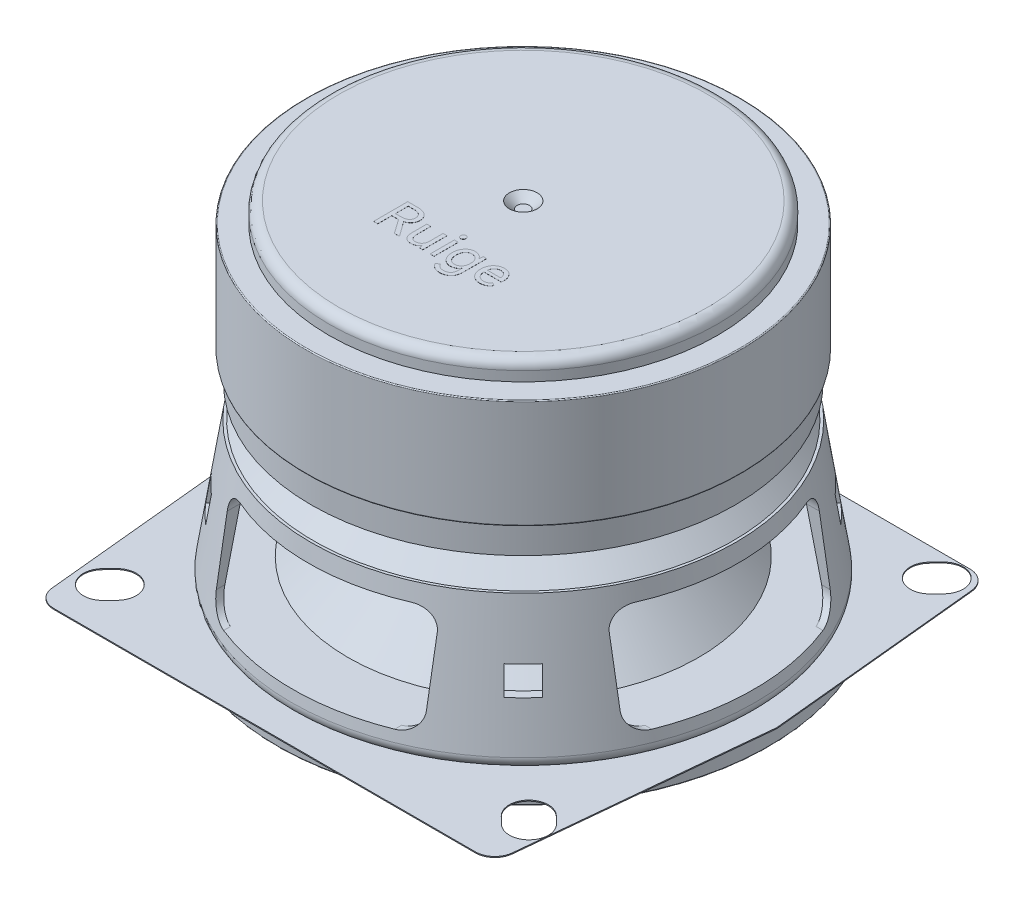
from build123d import *

# Parameters (mm, degrees)
SKETCH_2_R               = 19.925
EXTRUDE_1_DEPTH          = 2
SKETCH_3_R               = 22.3
EXTRUDE_2_DEPTH          = 11.15
SKETCH_4_R               = 21.75
EXTRUDE_3_DEPTH          = 3
SKETCH_5_R               = 18.225
EXTRUDE_4_DEPTH          = 3.3
EXTRUDE_4_DRAFT          = -45
EXTRUDE_5_DEPTH          = 0.1
SKETCH_12_R              = 25.25
EXTRUDE_7_DEPTH          = 2
FILLET_1_R               = 1
FILLET_2_R               = 0.1
FILLET_5_R               = 0.1
CUT_EXTRUDE_3_DEPTH      = 52.643943488
PATTERN_CIRCULAR_1_COUNT = 4
SKETCH_17_R              = 23
CUT_EXTRUDE_4_DEPTH      = 12.125994
CUT_EXTRUDE_4_TAPER      = 12
EXTRUDE_9_REACH          = 50.737
SKETCH_19_R              = 17.996686734
EXTRUDE_9_DRAFT          = 45
CUT_EXTRUDE_START        = -33.9
CUT_EXTRUDE_5_DEPTH      = 33.9
PATTERN_CIRCULAR_2_COUNT = 4
SKETCH_27_R              = 24.25
CUT_EXTRUDE_6_DEPTH      = 1
SKETCH_28_R              = 17.5
CUT_EXTRUDE_7_DEPTH      = 7
CUT_EXTRUDE_7_DRAFT      = -45
FILLET_6_R               = 0.1
SKETCH_30_W              = 0.406719368
SKETCH_30_H              = 2.481126482
EXTRUDE_11_DEPTH         = 0.01
CUT_EXTRUDE_START_2      = 30
SKETCH_31_W              = 2.706391377
SKETCH_31_H              = 2.784707462
CUT_EXTRUDE_8_DEPTH      = 10
PATTERN_CIRCULAR_3_COUNT = 4
FILLET_7_R               = 1
FILLET_8_R               = 1


# Read off the part's stored shape, not the designer's step: 曲面-缝合2
with BuildPart() as part:
    # 草图2 → 凸台-拉伸1 (new body)
    with BuildSketch(Plane(origin=(0, 0, 0), x_dir=(1, 0, 0), z_dir=(0, 1, 0))):
        with Locations(Location((0, 0, 0), (0, 0, 270))):
            Circle(SKETCH_2_R)
    extrude(amount=-EXTRUDE_1_DEPTH)

    # 草图14 → 切除-旋转1 (revolve, cut)
    with BuildSketch(Plane.XY, mode=Mode.PRIVATE) as cut_revolve_1_sk:
        Polygon((0, 0), (0, -0.717703915), (0.633716951, -0.717703915), (1.426933152, 0), align=None)
    revolve(cut_revolve_1_sk.sketch.rotate(Axis((0, 0, 0), (0, -1, 0)), 270), axis=Axis((0, 0, 0), (0, -1, 0)), mode=Mode.SUBTRACT)

    # 圆角1
    fillet_1_edges = [part.edges().sort_by_distance(p)[0] for p in [
        (0, 0, -19.925),
    ]]
    fillet(fillet_1_edges, radius=FILLET_1_R)

    # 草图30 → 凸台-拉伸11 (add)
    # profile 1 of 6: a face of its own
    with BuildSketch(Plane(origin=(0, 0, 0), x_dir=(1, 0, 0), z_dir=(0, 1, 0))):
        with BuildLine():
            Line((-3.189977143, -9.508206591), (-3.711518645, -9.508206591))
            Line((-3.711518645, -9.508206591), (-4.724858565, -8.073621611))
            Line((-4.724858565, -8.073621611), (-4.767743941, -8.073621611))
            Line((-4.767743941, -8.073621611), (-5.417941569, -8.073621611))
            Line((-5.417941569, -8.073621611), (-5.417941569, -9.508206591))
            Line((-5.417941569, -9.508206591), (-5.844028526, -9.508206591))
            Line((-5.844028526, -9.508206591), (-5.844028526, -6.008206591))
            Line((-5.844028526, -6.008206591), (-4.767743941, -6.008206591))
            add(Edge.make_bspline(
                [(-4.767743941, -6.008206591), (-4.70955201, -6.009767727), (-4.595872808, -6.01281744), (-4.430543422, -6.03754974), (-4.274878485, -6.077294392), (-4.153398813, -6.125045973), (-4.062266763, -6.170555461), (-3.997880606, -6.207743839), (-3.937430612, -6.248811533), (-3.880890416, -6.293018597), (-3.827668416, -6.340105273), (-3.779572492, -6.391437805), (-3.734934017, -6.445717016), (-3.694278018, -6.503045755), (-3.65745215, -6.562864703), (-3.626314425, -6.625824059), (-3.599491507, -6.690508681), (-3.576754117, -6.75735909), (-3.560894465, -6.826554583), (-3.547739113, -6.897537495), (-3.541247241, -6.970932874), (-3.539944619, -7.020614984), (-3.539285443, -7.045755998)],
                knots=[0, 0, 0, 0, 1.934696954, 3.779472598, 5.546483382, 7.268182974, 8.108419679, 8.933114725, 9.739238456, 10.536928548, 11.31898344, 12.100135439, 12.873874383, 13.654800496, 14.436027776, 15.20767373, 15.988110199, 16.764125966, 17.552770483, 18.347062047, 19.163551324, 20, 20, 20, 20], degree=3))
            add(Edge.make_bspline(
                [(-3.539285443, -7.045755998), (-3.539680007, -7.073918297), (-3.540461879, -7.129724973), (-3.550819415, -7.211739879), (-3.565567295, -7.290971813), (-3.587440046, -7.367012503), (-3.614774665, -7.440323822), (-3.649206268, -7.51034914), (-3.688473091, -7.578160438), (-3.735148815, -7.641868893), (-3.785880629, -7.702992655), (-3.842450506, -7.758840629), (-3.902609103, -7.811458631), (-3.96869255, -7.858060435), (-4.038689009, -7.901045982), (-4.113067369, -7.94024851), (-4.192631903, -7.973880145), (-4.247926345, -7.992792934), (-4.275945522, -8.002376551)],
                knots=[0, 0, 0, 0, 1.040008213, 2.060890069, 3.050100258, 4.015617353, 4.980908869, 5.937361294, 6.895936475, 7.87251746, 8.852141338, 9.828127481, 10.806787564, 11.802179348, 12.811907597, 13.84086371, 14.905907697, 16, 16, 16, 16], degree=3))
            Line((-4.275945522, -8.002376551), (-3.189977143, -9.508206591))
        make_face()
        with BuildLine():
            Line((-5.417941569, -6.381724377), (-5.417941569, -7.700795524))
            Line((-5.417941569, -7.700795524), (-4.820313111, -7.700795524))
            add(Edge.make_bspline(
                [(-4.820313111, -7.700795524), (-4.787552491, -7.700299923), (-4.723765511, -7.699334958), (-4.631119158, -7.690854923), (-4.544248608, -7.677578243), (-4.463942606, -7.657119145), (-4.389042171, -7.632663159), (-4.320746178, -7.601218611), (-4.257550365, -7.565533731), (-4.201770653, -7.522914976), (-4.151531445, -7.476507335), (-4.10788884, -7.425948376), (-4.07061385, -7.371585591), (-4.041248766, -7.3131601), (-4.017081975, -7.251737034), (-4.000739626, -7.186414121), (-3.990914775, -7.117300749), (-3.989576217, -7.069998921), (-3.988890186, -7.045755998)],
                knots=[0, 0, 0, 0, 1.314087679, 2.558611031, 3.729626903, 4.835706093, 5.880026302, 6.885990906, 7.847505876, 8.78550528, 9.695301978, 10.587288996, 11.459633258, 12.332565881, 13.205253402, 14.102691954, 15.027600109, 16, 16, 16, 16], degree=3))
            add(Edge.make_bspline(
                [(-3.988890186, -7.045755998), (-3.989604467, -7.021747994), (-3.991011456, -6.974457131), (-4.00060358, -6.905295153), (-4.017389385, -6.839433445), (-4.040870127, -6.777275992), (-4.070847496, -6.71845892), (-4.107802343, -6.663450827), (-4.151757149, -6.612283782), (-4.201459699, -6.564368704), (-4.257761776, -6.521318388), (-4.320459669, -6.483848959), (-4.38919931, -6.452218736), (-4.463643745, -6.425698608), (-4.544288157, -6.405706511), (-4.631148696, -6.39254529), (-4.723724391, -6.382946294), (-4.787545808, -6.382138907), (-4.820313111, -6.381724377)],
                knots=[0, 0, 0, 0, 0.958943898, 1.888923538, 2.782433681, 3.668508104, 4.53761959, 5.413778369, 6.308853537, 7.227314963, 8.166777724, 9.133430475, 10.138837689, 11.184606099, 12.285843585, 13.451733503, 14.691664551, 16, 16, 16, 16], degree=3))
            Line((-4.820313111, -6.381724377), (-5.417941569, -6.381724377))
        make_face(mode=Mode.SUBTRACT)
    # profile 2 of 6: a face of its own
    with BuildSketch(Plane(origin=(0, 0, 0), x_dir=(1, 0, 0), z_dir=(0, 1, 0))):
        with BuildLine():
            Line((-1.206874376, -7.022238211), (-0.800155008, -7.022238211))
            Line((-0.800155008, -7.022238211), (-0.800155008, -9.508206591))
            Line((-0.800155008, -9.508206591), (-1.159147103, -9.508206591))
            add(Edge.make_bspline(
                [(-1.159147103, -9.508206591), (-1.160535092, -9.469228953), (-1.163197642, -9.394458963), (-1.17057106, -9.287745479), (-1.177676871, -9.191058254), (-1.184345526, -9.130292898), (-1.187506787, -9.101487223)],
                knots=[0, 0, 0, 0, 1.147570014, 2.201359651, 3.14735877, 4, 4, 4, 4], degree=3))
            add(Edge.make_bspline(
                [(-1.187506787, -9.101487223), (-1.208964182, -9.138250914), (-1.250988349, -9.210252358), (-1.332739145, -9.303466301), (-1.423276567, -9.384371252), (-1.526195961, -9.448220683), (-1.635817704, -9.499071087), (-1.751739365, -9.533622234), (-1.871778156, -9.557443283), (-1.953790782, -9.559653887), (-1.995411925, -9.560775761)],
                knots=[0, 0, 0, 0, 1.043107617, 2.042919323, 3.029902987, 4.014805639, 5.005420554, 5.988678049, 6.979260601, 8, 8, 8, 8], degree=3))
            add(Edge.make_bspline(
                [(-1.995411925, -9.560775761), (-2.027737465, -9.560033729), (-2.091023814, -9.558580991), (-2.183131491, -9.545624321), (-2.270728891, -9.525978908), (-2.352885692, -9.496654345), (-2.4308401, -9.459824811), (-2.503286935, -9.414017934), (-2.57104211, -9.360260828), (-2.633291694, -9.298645811), (-2.689433109, -9.229456829), (-2.738115434, -9.152835665), (-2.778801239, -9.06912449), (-2.812951683, -8.979206856), (-2.838286227, -8.881943334), (-2.856555896, -8.778312537), (-2.868993811, -8.667629163), (-2.869929609, -8.591510004), (-2.870411925, -8.552277737)],
                knots=[0, 0, 0, 0, 1.02646394, 2.009592267, 2.949556311, 3.87394986, 4.774974462, 5.683442121, 6.59063901, 7.517814613, 8.460486302, 9.41557047, 10.395089971, 11.412760249, 12.466412819, 13.582845246, 14.754184101, 16, 16, 16, 16], degree=3))
            Line((-2.870411925, -8.552277737), (-2.870411925, -7.022238211))
            Line((-2.870411925, -7.022238211), (-2.464384257, -7.022238211))
            Line((-2.464384257, -7.022238211), (-2.464384257, -8.4422975))
            add(Edge.make_bspline(
                [(-2.464384257, -8.4422975), (-2.464070583, -8.470903408), (-2.463459949, -8.526590858), (-2.456312046, -8.607426612), (-2.445332918, -8.683197933), (-2.430429623, -8.754090942), (-2.410211562, -8.819935468), (-2.386226238, -8.880924456), (-2.357759726, -8.936931602), (-2.324526608, -8.9874541), (-2.287222317, -9.032751389), (-2.245423919, -9.071905073), (-2.199185219, -9.104603387), (-2.149331429, -9.131732578), (-2.095120708, -9.152653232), (-2.037129647, -9.16771401), (-1.97472836, -9.176989226), (-1.931809012, -9.177831068), (-1.909641174, -9.178265879)],
                knots=[0, 0, 0, 0, 1.312331565, 2.5547309, 3.72033348, 4.82433299, 5.87524264, 6.877240598, 7.828343218, 8.75270601, 9.646781812, 10.515133921, 11.372393191, 12.238744858, 13.113070833, 14.031785177, 14.983417282, 16, 16, 16, 16], degree=3))
            add(Edge.make_bspline(
                [(-1.909641174, -9.178265879), (-1.879605904, -9.177116785), (-1.820302051, -9.174847929), (-1.732610121, -9.159276715), (-1.648065454, -9.132894533), (-1.566796501, -9.095920359), (-1.489982354, -9.049598298), (-1.420503397, -8.991025527), (-1.359087426, -8.922035777), (-1.304382979, -8.8437073), (-1.260788829, -8.754414729), (-1.228915172, -8.655528901), (-1.210137514, -8.546991764), (-1.207988207, -8.471655205), (-1.206874376, -8.432613705)],
                knots=[0, 0, 0, 0, 0.940580303, 1.857151149, 2.779931299, 3.707502802, 4.647556224, 5.580509548, 6.541874121, 7.533440932, 8.563698858, 9.641625836, 10.777824937, 12, 12, 12, 12], degree=3))
            Line((-1.206874376, -8.432613705), (-1.206874376, -7.022238211))
        make_face()
    # profile 3 of 6: a face of its own
    with BuildSketch(Plane(origin=(0, 0, 0), x_dir=(1, 0, 0), z_dir=(0, 1, 0))):
        with BuildLine():
            add(Edge.make_bspline(
                [(0.157157245, -6.582317263), (0.139300345, -6.581185004), (0.10429795, -6.578965596), (0.053709163, -6.563361081), (0.007893929, -6.535999917), (-0.032799, -6.49960513), (-0.067420285, -6.456848843), (-0.091568274, -6.408806718), (-0.108134342, -6.358133467), (-0.109724725, -6.322831612), (-0.110530502, -6.304945721)],
                knots=[0, 0, 0, 0, 1.004394132, 1.968774074, 2.945640664, 3.984309649, 5.027829232, 6.020083187, 6.996863615, 8, 8, 8, 8], degree=3))
            add(Edge.make_bspline(
                [(-0.110530502, -6.304945721), (-0.109687482, -6.287072613), (-0.108013158, -6.251574784), (-0.091900451, -6.200712944), (-0.067176303, -6.152937112), (-0.032830322, -6.110271323), (0.007901752, -6.07389527), (0.053707163, -6.046529405), (0.104298472, -6.030926096), (0.139300522, -6.028706522), (0.157157245, -6.02757418)],
                knots=[0, 0, 0, 0, 1.003023882, 1.992108573, 2.972734647, 4.016137197, 5.054689694, 6.031446727, 6.995718512, 8, 8, 8, 8], degree=3))
            add(Edge.make_bspline(
                [(0.157157245, -6.02757418), (0.175721416, -6.028377995), (0.211910603, -6.02994496), (0.263775518, -6.046029866), (0.311028347, -6.071961723), (0.351981587, -6.108207898), (0.386298808, -6.150463519), (0.412234129, -6.197820333), (0.427023224, -6.250118395), (0.428786353, -6.28640961), (0.429686889, -6.304945721)],
                knots=[0, 0, 0, 0, 1.027222024, 2.00247727, 2.981500095, 3.997108382, 5.015933681, 5.988837292, 6.972777976, 8, 8, 8, 8], degree=3))
            add(Edge.make_bspline(
                [(0.429686889, -6.304945721), (0.428854783, -6.322819099), (0.427212432, -6.358096258), (0.410964175, -6.409159678), (0.385017816, -6.456910668), (0.349185208, -6.49944668), (0.307801755, -6.536058165), (0.261260931, -6.563369506), (0.210226532, -6.578893648), (0.175010621, -6.581165503), (0.157157245, -6.582317263)],
                knots=[0, 0, 0, 0, 0.995440633, 1.964727503, 2.961416234, 4.013131, 5.053515803, 6.034024399, 7.003311269, 8, 8, 8, 8], degree=3))
        make_face()
    # profile 4 of 6: a face of its own
    with BuildSketch(Plane(origin=(0, 0, 0), x_dir=(1, 0, 0), z_dir=(0, 1, 0))):
        with Locations((0.155082146, -8.26764335)):
            Rectangle(SKETCH_30_W, SKETCH_30_H)
    # profile 5 of 6: a face of its own
    with BuildSketch(Plane(origin=(0, 0, 0), x_dir=(1, 0, 0), z_dir=(0, 1, 0))):
        with BuildLine():
            Line((3.268422067, -7.022238211), (3.268422067, -9.350499081))
            add(Edge.make_bspline(
                [(3.268422067, -9.350499081), (3.267354786, -9.408404324), (3.265292453, -9.520296081), (3.249718177, -9.681582794), (3.222618964, -9.829810498), (3.186396804, -9.965477324), (3.136425587, -10.087257257), (3.078310336, -10.197068857), (3.007541436, -10.293194542), (2.926115541, -10.375282209), (2.837692151, -10.445624394), (2.74524951, -10.506819843), (2.648901362, -10.559140297), (2.548146192, -10.60111376), (2.443705269, -10.634926633), (2.334998134, -10.658092657), (2.222255839, -10.672261397), (2.145835459, -10.674147024), (2.107058431, -10.675103824)],
                knots=[0, 0, 0, 0, 1.387567974, 2.681232473, 3.877697983, 4.995691513, 6.039179059, 7.025636496, 7.966083473, 8.888172103, 9.788194353, 10.669362649, 11.542053707, 12.411239405, 13.281443111, 14.169032291, 15.070935183, 16, 16, 16, 16], degree=3))
            add(Edge.make_bspline(
                [(2.107058431, -10.675103824), (2.076844929, -10.674451271), (2.017033677, -10.673159465), (1.92849899, -10.66654148), (1.842613709, -10.653883207), (1.759412484, -10.636716461), (1.678848688, -10.614339875), (1.600475342, -10.58775687), (1.52513174, -10.554597649), (1.451878862, -10.518590796), (1.383022055, -10.477394388), (1.319642437, -10.431504539), (1.262241573, -10.381520722), (1.209607234, -10.328084707), (1.163551145, -10.269778437), (1.122498495, -10.20819757), (1.087248511, -10.142483933), (1.069048223, -10.096125565), (1.059825229, -10.072633468)],
                knots=[0, 0, 0, 0, 1.126863424, 2.230761376, 3.308088145, 4.362001396, 5.396623865, 6.424435996, 7.445030255, 8.463993448, 9.466684361, 10.433223884, 11.377948486, 12.302143894, 13.22597928, 14.144075382, 15.059510446, 16, 16, 16, 16], degree=3))
            Line((1.059825229, -10.072633468), (1.38976594, -9.885874575))
            add(Edge.make_bspline(
                [(1.38976594, -9.885874575), (1.405969118, -9.918359806), (1.437689687, -9.981955356), (1.50300288, -10.064512096), (1.577002666, -10.136152314), (1.663115346, -10.193733214), (1.760263344, -10.238532956), (1.868020128, -10.269614011), (1.986421448, -10.289675956), (2.068926814, -10.291594602), (2.111900328, -10.292593943)],
                knots=[0, 0, 0, 0, 0.986581066, 1.931405895, 2.851090693, 3.78315513, 4.738672708, 5.754261975, 6.830291184, 8, 8, 8, 8], degree=3))
            add(Edge.make_bspline(
                [(2.111900328, -10.292593943), (2.14028405, -10.291893661), (2.19560816, -10.290528709), (2.276265156, -10.280971604), (2.352092416, -10.264060113), (2.423611086, -10.241858604), (2.489930756, -10.211173203), (2.552549319, -10.175892025), (2.609416925, -10.132024208), (2.662866869, -10.082972693), (2.710676116, -10.024668854), (2.751452634, -9.956001759), (2.785774482, -9.877353758), (2.813961509, -9.789001497), (2.835787148, -9.691062451), (2.851691493, -9.583358053), (2.860206064, -9.465458412), (2.861645294, -9.383482798), (2.862394399, -9.340815286)],
                knots=[0, 0, 0, 0, 0.979769389, 1.909716748, 2.79803167, 3.658858974, 4.488814631, 5.316094608, 6.134289243, 6.962066787, 7.816060114, 8.726491223, 9.709971201, 10.772136686, 11.922898153, 13.170055792, 14.527041492, 16, 16, 16, 16], degree=3))
            Line((2.862394399, -9.340815286), (2.862394399, -9.125696709))
            add(Edge.make_bspline(
                [(2.862394399, -9.125696709), (2.838701987, -9.160819244), (2.792260033, -9.229666566), (2.706815624, -9.31847899), (2.614060527, -9.395035942), (2.511632294, -9.455592985), (2.403518997, -9.502840976), (2.29052607, -9.535953283), (2.173764664, -9.556740228), (2.09446335, -9.559423288), (2.054489261, -9.560775761)],
                knots=[0, 0, 0, 0, 1.058392397, 2.074664658, 3.071289606, 4.059798142, 5.041666933, 6.016526416, 7.000173572, 8, 8, 8, 8], degree=3))
            add(Edge.make_bspline(
                [(2.054489261, -9.560775761), (2.007991961, -9.558932203), (1.915236781, -9.555254579), (1.778508464, -9.524871342), (1.645814737, -9.476153575), (1.540443915, -9.419284884), (1.458954229, -9.365942645), (1.400931849, -9.319785336), (1.345368743, -9.270221421), (1.293532075, -9.215570319), (1.243285965, -9.157793763), (1.197268757, -9.094432399), (1.15355246, -9.027428903), (1.113290346, -8.956167002), (1.077793163, -8.880844805), (1.045309469, -8.802687079), (1.019726951, -8.720727584), (0.996874763, -8.636242059), (0.980958421, -8.547998477), (0.967986706, -8.456690292), (0.961481838, -8.36192293), (0.960185534, -8.29773963), (0.959528786, -8.265222401)],
                knots=[0, 0, 0, 0, 1.474149278, 2.940708008, 4.422156041, 5.947400143, 6.728641115, 7.510224601, 8.297676016, 9.089364625, 9.898805631, 10.725585592, 11.571818849, 12.436665928, 13.320249657, 14.212874383, 15.119865783, 16.042654519, 16.98827688, 17.962972923, 18.967979574, 20, 20, 20, 20], degree=3))
            add(Edge.make_bspline(
                [(0.959528786, -8.265222401), (0.959788422, -8.232694203), (0.960301081, -8.168466054), (0.96852761, -8.073858045), (0.979970475, -7.982146139), (0.99640232, -7.893854912), (1.018163214, -7.808687249), (1.044196461, -7.726577382), (1.075354604, -7.647518215), (1.111418543, -7.572067761), (1.151553054, -7.500466433), (1.194250697, -7.432636308), (1.239918094, -7.369299402), (1.289324524, -7.310937316), (1.342006598, -7.257093507), (1.397268065, -7.206888373), (1.456184872, -7.161986135), (1.538062915, -7.108897913), (1.644366228, -7.053083492), (1.777850894, -7.004776348), (1.915102377, -6.975426953), (2.008006534, -6.971589189), (2.054489261, -6.969669041)],
                knots=[0, 0, 0, 0, 1.029919977, 2.033615691, 3.005539346, 3.956579852, 4.875826833, 5.788085456, 6.683111172, 7.565051714, 8.434661075, 9.281527551, 10.102461249, 10.905663526, 11.700958861, 12.486945865, 13.268373622, 14.044150574, 15.576074162, 17.059124696, 18.528592174, 20, 20, 20, 20], degree=3))
            add(Edge.make_bspline(
                [(2.054489261, -6.969669041), (2.095394751, -6.971185419), (2.176881234, -6.974206144), (2.297154897, -6.996901012), (2.413977495, -7.034742581), (2.526101689, -7.087324483), (2.632733656, -7.153002423), (2.727772139, -7.235671007), (2.812373353, -7.332173048), (2.857860108, -7.40541762), (2.881070288, -7.442791571)],
                knots=[0, 0, 0, 0, 0.982847623, 1.957898417, 2.930615343, 3.927349737, 4.928389034, 5.930471017, 6.943997204, 8, 8, 8, 8], degree=3))
            add(Edge.make_bspline(
                [(2.881070288, -7.442791571), (2.888298071, -7.37021584), (2.902230076, -7.230321567), (2.907557879, -7.089839571), (2.910121672, -7.022238211)],
                knots=[0, 0, 0, 0, 1.037579736, 2, 2, 2, 2], degree=3))
            Line((2.910121672, -7.022238211), (3.268422067, -7.022238211))
        make_face()
        with BuildLine():
            add(Edge.make_bspline(
                [(2.102216533, -9.178265879), (2.127613684, -9.177608588), (2.177931174, -9.176306346), (2.251863169, -9.165732772), (2.323231183, -9.148349434), (2.391655617, -9.123902014), (2.45810483, -9.093654732), (2.520869128, -9.055036916), (2.581726488, -9.010677981), (2.638825996, -8.958852419), (2.692158656, -8.900118232), (2.737688959, -8.832344156), (2.776685895, -8.756941254), (2.808351445, -8.673850016), (2.832324084, -8.582638045), (2.850321139, -8.483940555), (2.860512132, -8.377030849), (2.861753588, -8.303287184), (2.862394399, -8.265222401)],
                knots=[0, 0, 0, 0, 0.90797867, 1.798910791, 2.664880779, 3.530732983, 4.394029247, 5.270806478, 6.161395104, 7.083823891, 8.02403018, 8.991467598, 9.994617027, 11.054327459, 12.164457308, 13.362943767, 14.638812269, 16, 16, 16, 16], degree=3))
            add(Edge.make_bspline(
                [(2.862394399, -8.265222401), (2.861756794, -8.227388732), (2.860525643, -8.154335746), (2.850366409, -8.048559253), (2.832112925, -7.9508513), (2.80852997, -7.860214158), (2.776472625, -7.777516362), (2.737925673, -7.702324257), (2.691917104, -7.635103847), (2.638857887, -7.576408889), (2.581709646, -7.524634864), (2.520904432, -7.480173016), (2.457898955, -7.441856773), (2.391992395, -7.410325137), (2.323053729, -7.387197449), (2.251891713, -7.369477299), (2.177923793, -7.35900017), (2.127611208, -7.357684758), (2.102216533, -7.35702082)],
                knots=[0, 0, 0, 0, 1.357577949, 2.621345624, 3.807657967, 4.921588707, 5.977205676, 6.983789713, 7.947709969, 8.89113536, 9.816722382, 10.710360227, 11.59013939, 12.459901171, 13.325995135, 14.194930053, 15.08891257, 16, 16, 16, 16], degree=3))
            add(Edge.make_bspline(
                [(2.102216533, -7.35702082), (2.075647918, -7.357508775), (2.023844527, -7.358460187), (1.948363168, -7.371043589), (1.876925269, -7.389466235), (1.808915018, -7.4151466), (1.745179905, -7.449029369), (1.686066622, -7.491323172), (1.630313499, -7.539842963), (1.579085285, -7.595881725), (1.533804448, -7.65912928), (1.493008527, -7.727696452), (1.460362869, -7.803087407), (1.432326257, -7.883658778), (1.411021532, -7.970524085), (1.396280249, -8.063544862), (1.386017169, -8.162392453), (1.385294442, -8.230379129), (1.384924043, -8.265222401)],
                knots=[0, 0, 0, 0, 0.976330282, 1.903645273, 2.806789368, 3.687347253, 4.571451925, 5.453927661, 6.355557015, 7.286124665, 8.239602965, 9.212796583, 10.215230919, 11.255974219, 12.348318781, 13.500098107, 14.718796573, 16, 16, 16, 16], degree=3))
            add(Edge.make_bspline(
                [(1.384924043, -8.265222401), (1.385286799, -8.300527263), (1.385992463, -8.369205497), (1.396292246, -8.46896831), (1.410989592, -8.562694229), (1.432499598, -8.650402807), (1.460028776, -8.7318617), (1.493239546, -8.80769351), (1.533580678, -8.876745248), (1.579104026, -8.940094505), (1.630341115, -8.996089744), (1.685844114, -9.044744824), (1.745412738, -9.086154109), (1.808884082, -9.120184337), (1.87693377, -9.145808308), (1.948360812, -9.164246479), (2.023845159, -9.176825609), (2.075648132, -9.177777618), (2.102216533, -9.178265879)],
                knots=[0, 0, 0, 0, 1.293269429, 2.515785494, 3.671563696, 4.767995356, 5.820807847, 6.819464788, 7.796291316, 8.746176699, 9.673237764, 10.571469579, 11.445774316, 12.326547487, 13.203787235, 14.103528084, 15.027348746, 16, 16, 16, 16], degree=3))
        make_face(mode=Mode.SUBTRACT)
    # profile 6 of 6: a face of its own
    with BuildSketch(Plane(origin=(0, 0, 0), x_dir=(1, 0, 0), z_dir=(0, 1, 0))):
        with BuildLine():
            add(Edge.make_bspline(
                [(5.057157245, -6.969669041), (5.083463952, -6.969927049), (5.135272099, -6.970435166), (5.211691089, -6.978668929), (5.28580186, -6.990384515), (5.357728466, -7.005711775), (5.426715988, -7.027624427), (5.493119301, -7.054078862), (5.557665917, -7.084243485), (5.639119692, -7.131254748), (5.733866601, -7.199417606), (5.83530243, -7.295075279), (5.920702659, -7.406192823), (5.992667028, -7.528573633), (6.049293985, -7.661363331), (6.089241125, -7.802230456), (6.114269135, -7.95007108), (6.117347344, -8.051155702), (6.118916138, -8.102672994)],
                knots=[0, 0, 0, 0, 0.724992502, 1.427792431, 2.116564281, 2.793707582, 3.453222815, 4.109605232, 4.763674536, 5.415794485, 6.700237486, 7.972810147, 9.245763864, 10.550886631, 11.878164362, 13.214243565, 14.580252596, 16, 16, 16, 16], degree=3))
            add(Edge.make_bspline(
                [(6.118916138, -8.102672994), (6.118253449, -8.145174641), (6.116981428, -8.226755865), (6.105194704, -8.307481519), (6.099548549, -8.346151255)],
                knots=[0, 0, 0, 0, 1.041946779, 2, 2, 2, 2], degree=3))
            Line((6.099548549, -8.346151255), (4.311505071, -8.346151255))
            add(Edge.make_bspline(
                [(4.311505071, -8.346151255), (4.313989157, -8.380561118), (4.318810579, -8.447348039), (4.334323074, -8.543966798), (4.355229532, -8.633887129), (4.383330184, -8.716799287), (4.416156732, -8.793333309), (4.455768467, -8.862977435), (4.501596554, -8.925768556), (4.553703039, -8.981187485), (4.610748394, -9.029509618), (4.671257437, -9.072149662), (4.735629323, -9.108261789), (4.80376303, -9.137064113), (4.874894235, -9.160485422), (4.950098141, -9.175972106), (5.028763674, -9.185887524), (5.08248904, -9.187255928), (5.109726415, -9.187949674)],
                knots=[0, 0, 0, 0, 1.270402116, 2.465753641, 3.600924155, 4.667274959, 5.686687033, 6.664373866, 7.612350246, 8.543781398, 9.459550565, 10.362067141, 11.267098308, 12.172727158, 13.083321442, 14.021236489, 14.996817948, 16, 16, 16, 16], degree=3))
            add(Edge.make_bspline(
                [(5.109726415, -9.187949674), (5.143212504, -9.186823291), (5.208238596, -9.184635985), (5.302497678, -9.169547218), (5.389513545, -9.143233661), (5.469351277, -9.106465355), (5.541500243, -9.058461801), (5.607181589, -9.000771296), (5.665012837, -8.931764766), (5.69627875, -8.879682867), (5.712196771, -8.853167065)],
                knots=[0, 0, 0, 0, 1.106054763, 2.147829746, 3.142897553, 4.100413216, 5.040442446, 5.995531711, 6.979490264, 8, 8, 8, 8], degree=3))
            Line((5.712196771, -8.853167065), (6.022769893, -9.030242164))
            add(Edge.make_bspline(
                [(6.022769893, -9.030242164), (6.014427837, -9.050955495), (5.997830133, -9.09216761), (5.965681754, -9.150151255), (5.928593044, -9.204747923), (5.886594211, -9.255843112), (5.83909551, -9.303039147), (5.786939906, -9.346959276), (5.729226312, -9.387116131), (5.645697824, -9.435481569), (5.533484165, -9.485646452), (5.391192768, -9.529478101), (5.240942161, -9.55549061), (5.138417876, -9.558992477), (5.086208628, -9.560775761)],
                knots=[0, 0, 0, 0, 0.702046881, 1.396821982, 2.080948413, 2.77666974, 3.474317387, 4.184895915, 4.919473551, 5.683446526, 7.21925995, 8.775092359, 10.35775491, 12, 12, 12, 12], degree=3))
            add(Edge.make_bspline(
                [(5.086208628, -9.560775761), (5.05851871, -9.560516632), (5.003720534, -9.560003819), (4.922717121, -9.551693834), (4.843646459, -9.540332824), (4.766492126, -9.523545349), (4.690957556, -9.502043694), (4.617124018, -9.47601065), (4.545382591, -9.44449558), (4.475907739, -9.408612619), (4.408577753, -9.36898149), (4.345621561, -9.32326653), (4.28507459, -9.274622544), (4.229144399, -9.220198862), (4.17649106, -9.161969276), (4.126932467, -9.099719346), (4.082421061, -9.03202984), (4.039816268, -8.961249946), (4.002505194, -8.885544688), (3.970333077, -8.806136347), (3.942072178, -8.723402804), (3.920620821, -8.63668768), (3.902091884, -8.54658402), (3.889936569, -8.452724753), (3.883136146, -8.355245033), (3.881898865, -8.289211987), (3.881267917, -8.255538607)],
                knots=[0, 0, 0, 0, 0.996902907, 1.972864621, 2.930095546, 3.873244509, 4.814380267, 5.75738296, 6.690865885, 7.63430732, 8.572911313, 9.501653459, 10.434249323, 11.368138535, 12.308907792, 13.26093673, 14.230659485, 15.224825783, 16.235061639, 17.266813331, 18.309437592, 19.381030963, 20.482052878, 21.621372957, 22.787025337, 24, 24, 24, 24], degree=3))
            add(Edge.make_bspline(
                [(3.881267917, -8.255538607), (3.881904192, -8.223018148), (3.883155588, -8.159058405), (3.889920355, -8.064566268), (3.902166116, -7.973254423), (3.920585493, -7.885434643), (3.942217863, -7.800612158), (3.970155835, -7.719611044), (4.002782842, -7.641763231), (4.039980808, -7.567352734), (4.081454903, -7.496543649), (4.127309844, -7.430390643), (4.175725942, -7.367776767), (4.227486368, -7.309503887), (4.28318007, -7.256357268), (4.341475908, -7.206644768), (4.403575736, -7.16195157), (4.46890884, -7.121775362), (4.536375523, -7.085970837), (4.605850865, -7.054586048), (4.677090316, -7.028391937), (4.749871581, -7.006910668), (4.824260362, -6.990104319), (4.900348515, -6.978802661), (4.978118713, -6.970431529), (5.030618807, -6.969925059), (5.057157245, -6.969669041)],
                knots=[0, 0, 0, 0, 1.198513757, 2.357181702, 3.489123074, 4.590582444, 5.662242429, 6.712845736, 7.74486878, 8.770823008, 9.776307263, 10.766161278, 11.734931765, 12.691742357, 13.63517989, 14.569698735, 15.512983212, 16.451472109, 17.39410582, 18.325839438, 19.258657189, 20.188878661, 21.12061228, 22.066342681, 23.022549465, 24, 24, 24, 24], degree=3))
        make_face()
        with BuildLine():
            add(Edge.make_bspline(
                [(5.042631553, -7.342495128), (5.020697386, -7.342995042), (4.977360741, -7.34398275), (4.913558347, -7.35279107), (4.851654779, -7.365626101), (4.79192516, -7.38449157), (4.734374185, -7.408584553), (4.679247832, -7.438879645), (4.626243107, -7.474008202), (4.575410466, -7.514103511), (4.528491943, -7.55986205), (4.485398821, -7.610401572), (4.447210297, -7.666066074), (4.414032199, -7.726710853), (4.384992713, -7.79198137), (4.359916127, -7.862175729), (4.339929161, -7.937403282), (4.330720892, -7.989616382), (4.326030763, -8.016210543)],
                knots=[0, 0, 0, 0, 0.974181983, 1.924749541, 2.857143545, 3.780657673, 4.703546441, 5.625069315, 6.571320365, 7.5265696, 8.497459598, 9.478727416, 10.473382572, 11.491402847, 12.546238478, 13.644799345, 14.800404723, 16, 16, 16, 16], degree=3))
            Line((4.326030763, -8.016210543), (5.678995189, -8.016210543))
            add(Edge.make_bspline(
                [(5.678995189, -8.016210543), (5.677304909, -7.990118808), (5.674016156, -7.939352524), (5.662827549, -7.865818145), (5.646992041, -7.796856237), (5.626160992, -7.732302698), (5.600920238, -7.671727319), (5.569412427, -7.616467762), (5.534008085, -7.565104067), (5.493095269, -7.5189771), (5.448266238, -7.477632923), (5.400239404, -7.441204507), (5.348714326, -7.410627354), (5.293743023, -7.38560689), (5.235502417, -7.366317298), (5.174123662, -7.35246176), (5.109502498, -7.34399358), (5.06525327, -7.343002038), (5.042631553, -7.342495128)],
                knots=[0, 0, 0, 0, 1.206755296, 2.347965007, 3.429941462, 4.470212713, 5.476652564, 6.453783143, 7.401774207, 8.352153161, 9.293847203, 10.213624225, 11.130130315, 12.054332322, 12.996928514, 13.95762573, 14.95586853, 16, 16, 16, 16], degree=3))
        make_face(mode=Mode.SUBTRACT)
    extrude(amount=EXTRUDE_11_DEPTH)


with BuildPart() as body_2:
    # 草图3 → 凸台-拉伸2 (new body)
    with BuildSketch(Plane.XZ.offset(2)):
        with Locations(Location((0, 0, 0), (0, 0, 270))):
            Circle(SKETCH_3_R)
    extrude(amount=EXTRUDE_2_DEPTH)

    # 草图4 → 凸台-拉伸3 (add)
    with BuildSketch(Plane.XZ.offset(13.15)):
        with Locations(Location((0, 0, 0), (0, 0, 270))):
            Circle(SKETCH_4_R)
    extrude(amount=EXTRUDE_3_DEPTH)


with BuildPart() as extrude_4_tool:
    # 草图5 → 凸台-拉伸4 (with draft: the straight prism first)
    with BuildSketch(Plane(origin=(0, -16.15, 0), x_dir=(-1, 0, 0), z_dir=(0, -1, 0))):
        Circle(SKETCH_5_R)
    extrude(amount=EXTRUDE_4_DEPTH)
    # 凸台-拉伸4: the draft: its side faces are tilted about the plane it starts from
    extrude_4_sides = [extrude_4_tool.faces().sort_by_distance(p)[0] for p in [
        (18.225, -17.8, 0),
    ]]
    draft(extrude_4_sides, Plane(origin=(0, -16.15, 0), x_dir=(-1, 0, 0), z_dir=(0, -1, 0)), EXTRUDE_4_DRAFT)


with BuildPart() as body_2_1:
    add(body_2.part)

    # 凸台-拉伸4: add extrude_4_tool
    add(extrude_4_tool.part)

    # 圆角2
    fillet_2_edges = [body_2_1.edges().sort_by_distance(p)[0] for p in [
        (0, -2, 22.3),
    ]]
    fillet(fillet_2_edges, radius=FILLET_2_R)

    # 圆角5
    fillet_5_edges = [body_2_1.edges().sort_by_distance(p)[0] for p in [
        (0, -13.15, 22.3),
    ]]
    fillet(fillet_5_edges, radius=FILLET_5_R)




with BuildPart() as body_3:
    # 草图11 → 凸台-拉伸5 (new body)
    with BuildSketch(Plane(origin=(0, -33.8, 0), x_dir=(-1, 0, 0), z_dir=(0, -1, 0))):
        with BuildLine():
            Line((21.830541038, 24), (-21.830541038, 24))
            ThreePointArc((-21.830541038, 24), (-23.173546947, 23.482003755), (-23.820880838, 22.196335129))
            Line((-23.820880838, 22.196335129), (-25.991049385, 0.196335129))
            ThreePointArc((-25.991049385, 0.196335129), (-26.000709585, 0), (-25.991049385, -0.196335129))
            Line((-25.991049385, -0.196335129), (-23.574270775, -24.696335129))
            ThreePointArc((-23.574270775, -24.696335129), (-22.926936885, -25.982003755), (-21.583930976, -26.5))
            Line((-21.583930976, -26.5), (21.693023621, -26.5))
            ThreePointArc((21.693023621, -26.5), (22.955360852, -26.013094435), (23.563757982, -24.804613882))
            Line((23.563757982, -24.804613882), (25.989642753, -0.196207972))
            ThreePointArc((25.989642753, -0.196207972), (25.999290415, 0), (25.989642753, 0.196207972))
            Line((25.989642753, 0.196207972), (23.820893377, 22.196207972))
            ThreePointArc((23.820893377, 22.196207972), (23.173594286, 23.481960854), (21.830541038, 24))
        make_face()
    extrude(amount=EXTRUDE_5_DEPTH)

    # 草图12 → 凸台-拉伸7 (add)
    with BuildSketch(Plane.XZ.offset(33.9)):
        with Locations(Location((0, 0, 0), (0, 0, 251.896186136))):
            Circle(SKETCH_12_R)
    extrude(amount=EXTRUDE_7_DEPTH)

    # 草图20 → 切除-拉伸5 (cut)
    with BuildSketch(Plane.XZ.offset(35.9).offset(CUT_EXTRUDE_START)):
        with BuildLine():
            Line((19.746834936, 22.007101354), (20.463501603, 22.704517219))
            ThreePointArc((20.463501603, 22.704517219), (23.291666667, 22.666015616), (23.253165064, 19.837850552))
            Line((23.253165064, 19.837850552), (22.536498397, 19.140434687))
            ThreePointArc((22.536498397, 19.140434687), (19.708333333, 19.17893629), (19.746834936, 22.007101354))
        make_face()
    cut_extrude_5 = extrude(amount=CUT_EXTRUDE_5_DEPTH, mode=Mode.SUBTRACT)

    # 阵列(圆周)2: 切除-拉伸5 ×4 about axis
    pattern_circular_2_axis = Axis((0, 0, 0), (0, 1, 0))
    for i in range(1, PATTERN_CIRCULAR_2_COUNT):
        add(cut_extrude_5.rotate(pattern_circular_2_axis, i * 360 / PATTERN_CIRCULAR_2_COUNT), mode=Mode.SUBTRACT)

    # 草图27 → 切除-拉伸6 (cut)
    with BuildSketch(Plane.XZ.offset(35.9)):
        with Locations(Location((0, 0, 0), (0, 0, 270))):
            Circle(SKETCH_27_R)
    extrude(amount=-CUT_EXTRUDE_6_DEPTH, mode=Mode.SUBTRACT)


with BuildPart() as body_4:
    # Knit 2 outline → Knit 2 (revolve)
    with BuildSketch(Plane.XY):
        Polygon((21.8, -19.45), (0, -19.45), (0, -33.8), (24, -33.8), align=None)
    revolve(axis=Axis((0, 0, 0), (0, 1, 0)))

    # 草图15 → 切除-拉伸3 (cut, symmetric)
    with BuildSketch(Plane.XY):
        with BuildLine():
            Line((-8.776386593, -21.162420253), (8.776386593, -21.162420253))
            ThreePointArc((8.776386593, -21.162420253), (10.190600155, -21.748206691), (10.776386593, -23.162420253))
            Line((10.776386593, -23.162420253), (10.776386593, -29.575994124))
            ThreePointArc((10.776386593, -29.575994124), (10.190600155, -30.990207686), (8.776386593, -31.575994124))
            Line((8.776386593, -31.575994124), (-8.776386593, -31.575994124))
            ThreePointArc((-8.776386593, -31.575994124), (-10.190600155, -30.990207686), (-10.776386593, -29.575994124))
            Line((-10.776386593, -29.575994124), (-10.776386593, -23.162420253))
            ThreePointArc((-10.776386593, -23.162420253), (-10.190600155, -21.748206691), (-8.776386593, -21.162420253))
        make_face()
    cut_extrude_3 = extrude(amount=CUT_EXTRUDE_3_DEPTH, both=True, mode=Mode.SUBTRACT)

    # 阵列(圆周)1: 切除-拉伸3 ×4 about axis
    pattern_circular_1_axis = Axis((0, -19.45, 0), (0, -1, 0))
    for i in range(1, PATTERN_CIRCULAR_1_COUNT):
        add(cut_extrude_3.rotate(pattern_circular_1_axis, i * 360 / PATTERN_CIRCULAR_1_COUNT), mode=Mode.SUBTRACT)

    # 草图17 → 切除-拉伸4 (cut)
    with BuildSketch(Plane(origin=(0, -31.575994124, 0), x_dir=(1, 0, 0), z_dir=(0, 1, 0))):
        Circle(SKETCH_17_R)
    extrude(amount=CUT_EXTRUDE_4_DEPTH, taper=CUT_EXTRUDE_4_TAPER, mode=Mode.SUBTRACT)


with BuildPart() as extrude_9_long_prism_1:
    # 草图19 → 凸台-拉伸9 (the long prism of profile 1, to be tilted and cut off)
    with BuildSketch(Plane(origin=(0, -31.575994124, 0), x_dir=(1, 0, 0), z_dir=(0, 1, 0))):
        Circle(SKETCH_19_R)
    extrude(amount=EXTRUDE_9_REACH)
    extrude_9_tool1_sides = [extrude_9_long_prism_1.faces().sort_by_distance(p)[0] for p in [
        (-17.996686734, -6.207494124, 0),
    ]]
    draft(extrude_9_tool1_sides, Plane(origin=(0, -31.575994124, 0), x_dir=(1, 0, 0), z_dir=(0, 1, 0)), EXTRUDE_9_DRAFT)  # the draft: side faces tilted about the start plane


with BuildPart() as body_2_2:
    add(body_2_1.part)
    extrude_9_tool1 = extrude_9_long_prism_1.part - body_2_1.part

    add(body_4.part)  # 凸台-拉伸9 merges body 4
    add(extrude_9_tool1.solids().sort_by_distance((0, -31.575994, 0))[0])


with BuildPart() as cut_extrude_7_tool:
    # 草图28 → 切除-拉伸7 (with draft: the straight prism first)
    with BuildSketch(Plane.XZ.offset(34.9)):
        Circle(SKETCH_28_R)
    extrude(amount=-CUT_EXTRUDE_7_DEPTH)
    # 切除-拉伸7: the draft: its side faces are tilted about the plane it starts from
    cut_extrude_7_sides = [cut_extrude_7_tool.faces().sort_by_distance(p)[0] for p in [
        (-17.5, -31.4, 0),
    ]]
    draft(cut_extrude_7_sides, Plane.XZ.offset(34.9), CUT_EXTRUDE_7_DRAFT)


with BuildPart() as body_2_3:
    add(body_2_2.part)

    # 切除-拉伸7: cut by cut_extrude_7_tool
    add(cut_extrude_7_tool.part, mode=Mode.SUBTRACT)

    # 草图29 → 旋转2 (revolve)
    with BuildSketch(Plane(origin=(0, 0, 0), x_dir=(0, 0, -1), z_dir=(1, 0, 0))):
        with BuildLine():
            Line((0.13557761, -20.403509327), (0.204660489, -30.800013355))
            ThreePointArc((0.204660489, -30.800013355), (5.368371063, -25.567219902), (0.13557761, -20.403509327))
        make_face()
    revolve(axis=Axis((0, -20.403509327, -0.13557761), (0, -0.9999779239267406, -0.0066446714866841726)))

    # 草图31 → 切除-拉伸8 (cut, symmetric)
    with BuildSketch(Plane(origin=(0, 0, 0), x_dir=(0, 1, 0), z_dir=(0.7071067811865464, 0, -0.7071067811865488)).offset(CUT_EXTRUDE_START_2)):
        with Locations((-26.482923107, 0)):
            Rectangle(SKETCH_31_W, SKETCH_31_H)
    cut_extrude_8 = extrude(amount=CUT_EXTRUDE_8_DEPTH, both=True, mode=Mode.SUBTRACT)

    # 阵列(圆周)3: 切除-拉伸8 ×4 about axis
    pattern_circular_3_axis = Axis((0, 0, 0), (0, 1, 0))
    for i in range(1, PATTERN_CIRCULAR_3_COUNT):
        add(cut_extrude_8.rotate(pattern_circular_3_axis, i * 360 / PATTERN_CIRCULAR_3_COUNT), mode=Mode.SUBTRACT)

    # 圆角7
    fillet_7_edges = [body_2_3.edges().sort_by_distance(p)[0] for p in [
        (-10.5, -27.9, 0),
        (-16.4, -33.8, 0),
        (0, -27.9, 4.492617934),
    ]]
    fillet(fillet_7_edges, radius=FILLET_7_R)

    # 圆角8
    fillet_8_edges = [body_2_3.edges().sort_by_distance(p)[0] for p in [
        (-24, -33.8, 0),
    ]]
    fillet(fillet_8_edges, radius=FILLET_8_R)


with BuildPart() as body_3_1:
    add(body_3.part)

    # 切除-拉伸7: cut by cut_extrude_7_tool
    add(cut_extrude_7_tool.part, mode=Mode.SUBTRACT)

    # 圆角6
    fillet_6_edges = [body_3_1.edges().sort_by_distance(p)[0] for p in [
        (7.846177413, -35.9, 24),
        (0, -35.9, 24.25),
        (-16.4, -33.8, 0),
        (-17.5, -34.9, 0),
    ]]
    fillet(fillet_6_edges, radius=FILLET_6_R)


solid = Compound([part.part, body_2_3.part, body_3_1.part])
